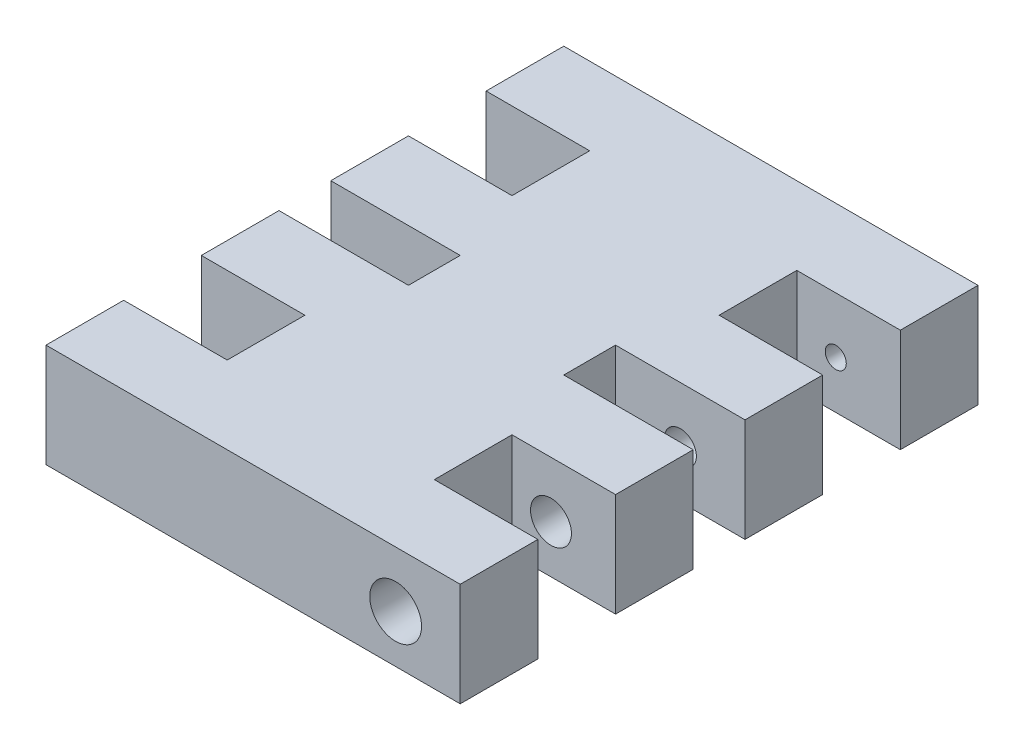
from build123d import *

# Parameters (mm, degrees)
BOSS_EXTRUDE1_DEPTH      = 10
BOSS_EXTRUDE1_DEPTH_BACK = 10


# Read off the part's stored shape, not the designer's step: Hole1
with BuildPart() as part:
    # Sketch1 → Boss-Extrude1 (new, two sides: drawn at the far end of the back side and taken through both)
    with BuildSketch(Plane(origin=(0, 0, 0), x_dir=(1, 0, 0), z_dir=(0, 1, 0)).offset(-BOSS_EXTRUDE1_DEPTH_BACK)):
        Polygon((41.092590889, 58.060996062), (-38.907409111, 58.060996062), (-38.907409111, 43.060996062), (-18.907409111, 43.060996062), (-18.907409111, 28.060996062), (-38.907409111, 28.060996062), (-38.907409111, 13.060996062), (-13.907409111, 13.060996062), (-13.907409111, 3.060996062), (-38.907409111, 3.060996062), (-38.907409111, -11.939003938), (-18.907409111, -11.939003938), (-18.907409111, -26.939003938), (-38.907409111, -26.939003938), (-38.907409111, -41.939003938), (41.092590889, -41.939003938), (41.092590889, -26.939003938), (21.092590889, -26.939003938), (21.092590889, -11.939003938), (41.092590889, -11.939003938), (41.092590889, 3.060996062), (16.092590889, 3.060996062), (16.092590889, 13.060996062), (41.092590889, 13.060996062), (41.092590889, 28.060996062), (21.092590889, 28.060996062), (21.092590889, 43.060996062), (41.092590889, 43.060996062), align=None)
    extrude(amount=BOSS_EXTRUDE1_DEPTH + BOSS_EXTRUDE1_DEPTH_BACK)

    # Hole1 outline → Hole1 (revolve, cut)
    with BuildSketch(Plane(origin=(28.620361889, -0.784426919, 0), x_dir=(1, 0, 0), z_dir=(0, -1, 0))):
        Polygon((5, 41.939003938), (0, 41.939003938), (0, 26.939003938), (4.476188458, 26.939003938), align=None)
        Polygon((3.428565373, -3.060996062), (3.952376915, 11.939003938), (0, 11.939003938), (0, -3.060996062), align=None)
        Polygon((2.555546136, -28.060996062), (3.079357678, -13.060996062), (0, -13.060996062), (0, -28.060996062), align=None)
        Polygon((1.507923051, -58.060996062), (2.031734593, -43.060996062), (0, -43.060996062), (0, -58.060996062), align=None)
    revolve(axis=Axis((28.620361889, -0.784426919, 0), (0, 0, 1)), mode=Mode.SUBTRACT)


solid = part.part
